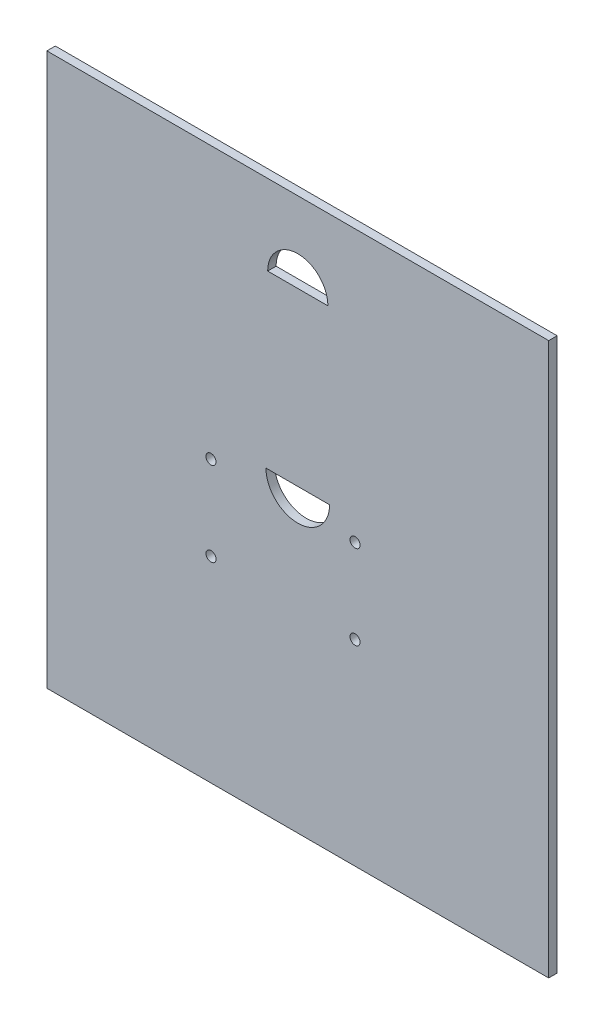
from build123d import *

# Parameters (mm, degrees)
SKETCH1_W               = 250
SKETCH1_H               = 275
BOSS_EXTRUDE1_DEPTH     = 4.2
ESQUISSE1_R             = 2.50000008
ENL_V_MAT_EXTRU_1_DEPTH = 276.146260086


with BuildPart() as part:
    # Sketch1 → Boss-Extrude1 (new body)
    with BuildSketch(Plane.XY):
        with Locations((-95.228215768, -27.385892116)):
            Rectangle(SKETCH1_W, SKETCH1_H)
    extrude(amount=BOSS_EXTRUDE1_DEPTH)

    # Esquisse1 → Enlèv. mat.-Extru.1 (cut, through all)
    with BuildSketch(Plane.XY.offset(4.2)):
        with Locations((-66.707433158, -67.065047239)):
            Circle(ESQUISSE1_R)
        with Locations((-66.707433158, -25.155047239)):
            Circle(ESQUISSE1_R)
        with Locations((-138.462433158, -67.065047239)):
            Circle(ESQUISSE1_R)
        with Locations((-138.462433158, -25.155047239)):
            Circle(ESQUISSE1_R)
        with BuildLine():
            Line((-110.228215768, 70.114107884), (-80.228215768, 70.114107884))
            ThreePointArc((-80.228215768, 70.114107884), (-95.228215768, 85.114107884), (-110.228215768, 70.114107884))
        make_face()
        with BuildLine():
            Line((-111.073893882, -15.305892116), (-79.382537653, -15.305892116))
            ThreePointArc((-79.382537653, -15.305892116), (-95.228215768, -31.151570231), (-111.073893882, -15.305892116))
        make_face()
    extrude(amount=-ENL_V_MAT_EXTRU_1_DEPTH, mode=Mode.SUBTRACT)


solid = part.part
